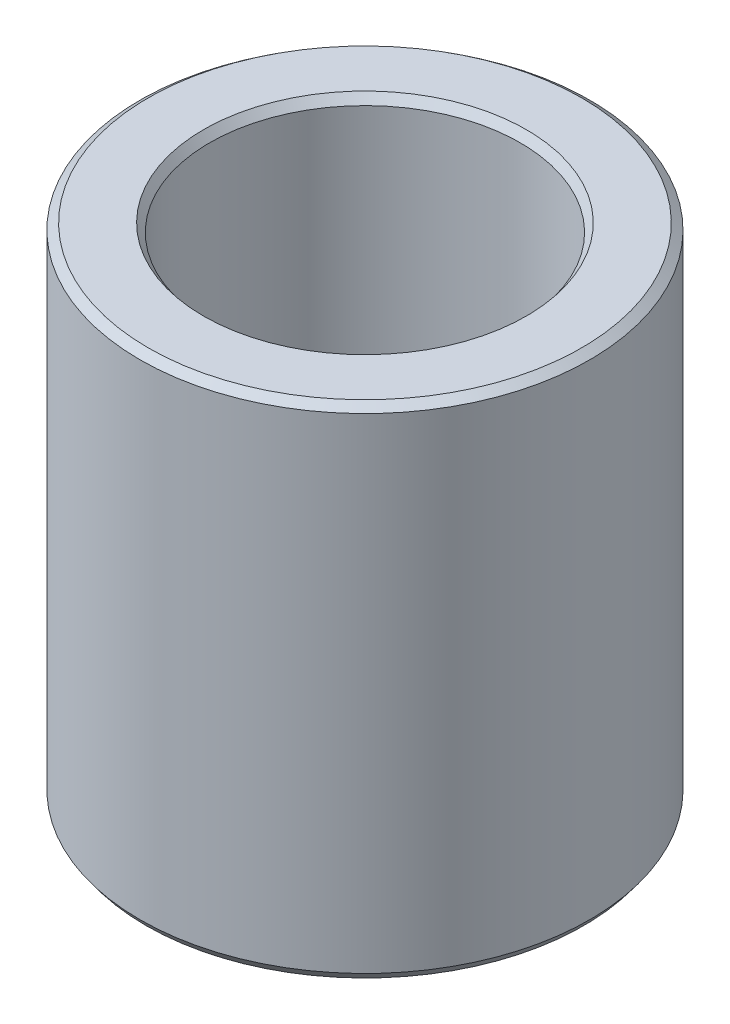
from build123d import *
from OCP.BRepFilletAPI import BRepFilletAPI_MakeChamfer

# Parameters (mm, degrees)
SKETCH1_R           = 15
BOSS_EXTRUDE1_DEPTH = 33.299449973
SKETCH2_R           = 10.359065682
CUT_EXTRUDE1_DEPTH  = 40.482317162
CHAMFER1_SIZE       = 0.409637355
CHAMFER1_SIZE2      = 0.551698027


with BuildPart() as part:
    # Sketch1 → Boss-Extrude1 (new body)
    with BuildSketch(Plane(origin=(0, 0, 0), x_dir=(1, 0, 0), z_dir=(0, 1, 0))):
        Circle(SKETCH1_R)
    extrude(amount=BOSS_EXTRUDE1_DEPTH)

    # Sketch2 → Cut-Extrude1 (cut, through all)
    with BuildSketch(Plane(origin=(0, 0, 0), x_dir=(1, 0, 0), z_dir=(0, 1, 0))):
        Circle(SKETCH2_R)
    extrude(amount=CUT_EXTRUDE1_DEPTH, mode=Mode.SUBTRACT)

    # Chamfer1: one chamfer whose edges measure the first distance from different faces: ONE call of the kernel's chamfer builder (chamfer() names one face for all edges)
    chamfer1_edges_1 = [part.edges().sort_by_distance(p)[0] for p in [
        (-10.359065682, 33.299449973, 0),
    ]]
    chamfer1_side_1 = [part.faces().sort_by_distance(p)[0] for p in [
        (-14.575735931, 33.299449973, 0),
    ]]
    chamfer1_edges_2 = [part.edges().sort_by_distance(p)[0] for p in [
        (-10.359065682, 0, 0),
    ]]
    chamfer1_side_2 = [part.faces().sort_by_distance(p)[0] for p in [
        (-10.359065682, 16.649724987, 0),
    ]]
    chamfer1_edges_3 = [part.edges().sort_by_distance(p)[0] for p in [
        (-15, 0, 0),
    ]]
    chamfer1_side_3 = [part.faces().sort_by_distance(p)[0] for p in [
        (-14.575735931, 0, 0),
    ]]
    chamfer1_edges_4 = [part.edges().sort_by_distance(p)[0] for p in [
        (-15, 33.299449973, 0),
    ]]
    chamfer1_side_4 = [part.faces().sort_by_distance(p)[0] for p in [
        (-15, 16.649724987, 0),
    ]]
    chamfer1 = BRepFilletAPI_MakeChamfer(part.part.solid().wrapped)
    for e in chamfer1_edges_1:
        chamfer1.Add(CHAMFER1_SIZE, CHAMFER1_SIZE2, e.wrapped, chamfer1_side_1[0].wrapped)  # the first distance lies on this face
    for e in chamfer1_edges_2:
        chamfer1.Add(CHAMFER1_SIZE, CHAMFER1_SIZE2, e.wrapped, chamfer1_side_2[0].wrapped)  # the first distance lies on this face
    for e in chamfer1_edges_3:
        chamfer1.Add(CHAMFER1_SIZE, CHAMFER1_SIZE2, e.wrapped, chamfer1_side_3[0].wrapped)  # the first distance lies on this face
    for e in chamfer1_edges_4:
        chamfer1.Add(CHAMFER1_SIZE, CHAMFER1_SIZE2, e.wrapped, chamfer1_side_4[0].wrapped)  # the first distance lies on this face
    add(Compound.cast(chamfer1.Shape()), mode=Mode.REPLACE)


solid = part.part
